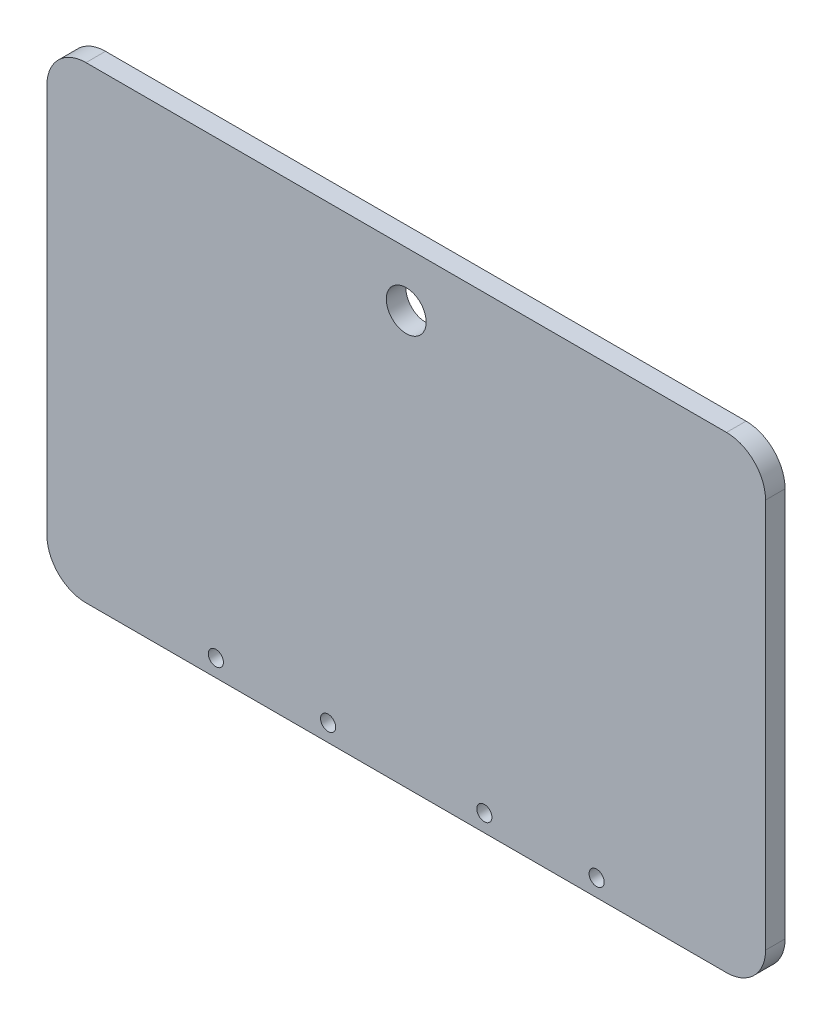
from build123d import *

# Parameters (mm, degrees)
SKETCH1_W             = 233.68
SKETCH1_H             = 152.146
BOSS_EXTRUDE1_DEPTH   = 6.35
F_8_CLEARANCE_HOLE1_D = 4.9149
SKETCH8_R             = 6.477
CUT_EXTRUDE1_DEPTH    = 279.917676414
FILLET1_R             = 12.7


with BuildPart() as part:
    # Sketch1 → Boss-Extrude1 (new body)
    with BuildSketch(Plane.XY):
        with Locations((116.84, 76.073)):
            Rectangle(SKETCH1_W, SKETCH1_H)
    extrude(amount=BOSS_EXTRUDE1_DEPTH)

    # #8 Clearance Hole1 (through all)
    with Locations(Plane.XY.offset(6.35)):
        with Locations((54.9275, 5.588), (91.44, 5.588), (142.24, 5.588), (178.7525, 5.588)):
            Hole(F_8_CLEARANCE_HOLE1_D / 2)

    # Sketch8 → Cut-Extrude1 (cut, through all)
    with BuildSketch(Plane.XY.offset(6.35)):
        with Locations((116.84, 134.366)):
            Circle(SKETCH8_R)
    extrude(amount=-CUT_EXTRUDE1_DEPTH, mode=Mode.SUBTRACT)

    # Fillet1
    fillet1_edges = [part.edges().sort_by_distance(p)[0] for p in [
        (233.68, 0, 3.175),
        (233.68, 152.146, 3.175),
        (0, 152.146, 3.175),
        (0, 0, 3.175),
    ]]
    fillet(fillet1_edges, radius=FILLET1_R)


solid = part.part
